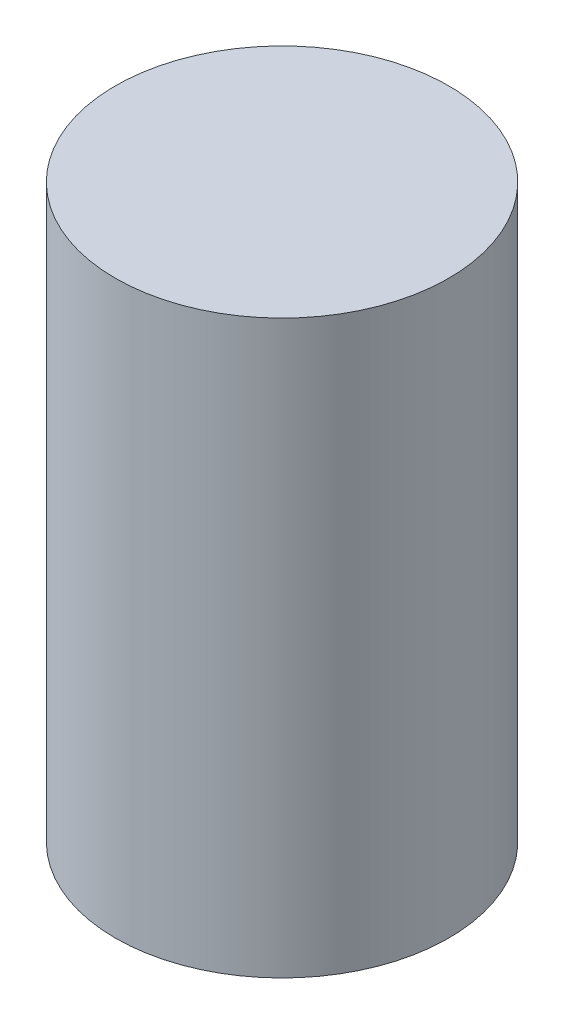
from build123d import *


with BuildPart() as part:
    # Sketch1 → Revolve1 (revolve)
    with BuildSketch(Plane.XY):
        Polygon((-2.5, 0), (-6.3, 0), (-6.3, 21.6), (0, 21.6), (0, 0), (0, -1.5), (-2.5, -1.5), align=None)
    revolve(axis=Axis((0, 0, 0), (0, -1, 0)))


solid = part.part
